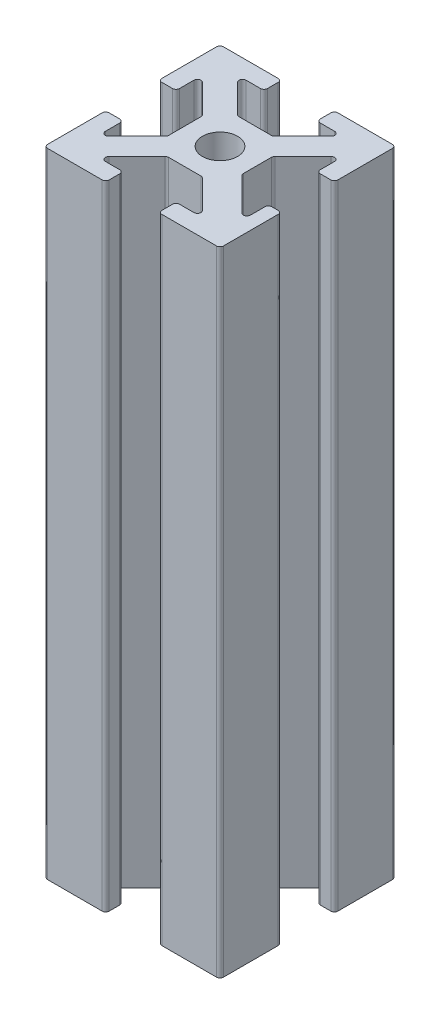
from build123d import *

# Parameters (mm, degrees)
ESQUISSE1_R        = 2
BOSS_EXTRU_1_DEPTH = 72
CONG_1_R           = 0.4


with BuildPart() as part:
    # Esquisse1 → Boss.-Extru.1 (new body)
    with BuildSketch(Plane(origin=(0, 0, 0), x_dir=(1, 0, 0), z_dir=(0, 1, 0))):
        Polygon((0, 0), (0, 7), (2, 7), (2, 4), (6, 8), (6, 12), (2, 16), (2, 13), (0, 13), (0, 20), (7, 20), (7, 18), (4, 18), (8, 14), (12, 14), (16, 18), (13, 18), (13, 20), (20, 20), (20, 13), (18, 13), (18, 16), (14, 12), (14, 8.5), (18.5, 4), (18.5, 7), (20, 7), (20, 0), (13, 0), (13, 2), (16, 2), (12, 6), (8, 6), (4, 2), (7, 2), (7, 0), align=None)
        with Locations((10, 10)):
            Circle(ESQUISSE1_R, mode=Mode.SUBTRACT)
    extrude(amount=BOSS_EXTRU_1_DEPTH)

    # Congé1
    cong_1_edges = [part.edges().sort_by_distance(p)[0] for p in [
        (4, 36, -18),
        (2, 36, -16),
        (6, 36, -12),
        (6, 36, -8),
        (2, 36, -4),
        (2, 36, -7),
        (0, 36, -7),
        (0, 36, 0),
        (7, 36, 0),
        (7, 36, -2),
        (4, 36, -2),
        (8, 36, -6),
        (12, 36, -6),
        (16, 36, -2),
        (13, 36, -2),
        (13, 36, 0),
        (20, 36, 0),
        (20, 36, -7),
        (18.5, 36, -7),
        (18.5, 36, -4),
        (14, 36, -8.5),
        (14, 36, -12),
        (18, 36, -16),
        (18, 36, -13),
        (20, 36, -13),
        (20, 36, -20),
        (13, 36, -20),
        (13, 36, -18),
        (16, 36, -18),
        (12, 36, -14),
        (8, 36, -14),
        (7, 36, -18),
        (7, 36, -20),
        (0, 36, -20),
        (0, 36, -13),
        (2, 36, -13),
    ]]
    fillet(cong_1_edges, radius=CONG_1_R)


solid = part.part
